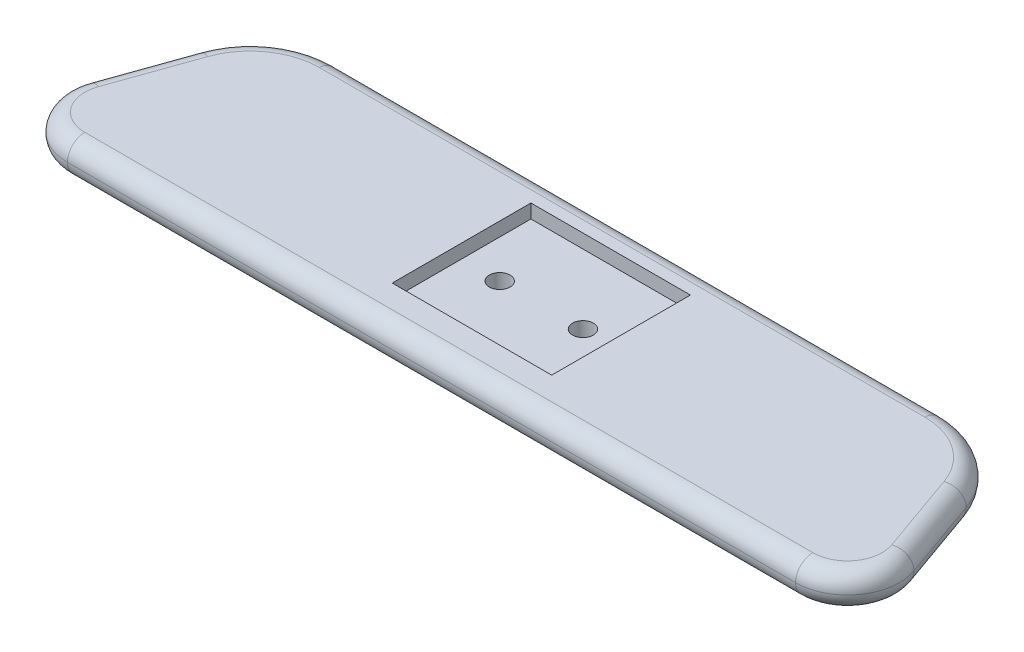
from build123d import *

# Parameters (mm, degrees)
BOSS_EXTRUDE1_DEPTH     = 5
CUT_EXTRUDE1_DEPTH      = 125.512560278
CUT_EXTRUDE1_DEPTH_BACK = 4
SKETCH2_W               = 46
SKETCH2_H               = 40
SKETCH3_R               = 3
CUT_EXTRUDE2_DEPTH      = 125.25529231
SKETCH4_R               = 2
CUT_EXTRUDE3_DEPTH      = 8
FILLET1_R               = 5


with BuildPart() as part:
    # Sketch1 → Boss-Extrude1 (new, symmetric)
    with BuildSketch(Plane(origin=(0, 0, 0), x_dir=(1, 0, 0), z_dir=(0, 1, 0))):
        with BuildLine():
            Line((-105, -31.676137185), (105, -31.676137185))
            ThreePointArc((105, -31.676137185), (117.249623327, -25.333315035), (119.139622366, -11.669034296))
            Line((119.139622366, -11.669034296), (110.875178831, 11.669034296))
            ThreePointArc((110.875178831, 11.669034296), (101.737771304, 23.739901694), (87.309141554, 28.323862815))
            Line((87.309141554, 28.323862815), (-87.309141554, 28.323862815))
            ThreePointArc((-87.309141554, 28.323862815), (-101.737771304, 23.739901694), (-110.875178831, 11.669034296))
            Line((-110.875178831, 11.669034296), (-119.139622366, -11.669034296))
            ThreePointArc((-119.139622366, -11.669034296), (-117.249623327, -25.333315035), (-105, -31.676137185))
        make_face()
    extrude(amount=BOSS_EXTRUDE1_DEPTH, both=True)

    # Sketch2 → Cut-Extrude1 (cut, two sides: drawn at the far end of the back side and taken through both)
    with BuildSketch(Plane(origin=(0, 5, 0), x_dir=(1, 0, 0), z_dir=(0, 1, 0)).offset(-CUT_EXTRUDE1_DEPTH_BACK)):
        Rectangle(SKETCH2_W, SKETCH2_H)
    extrude(amount=CUT_EXTRUDE1_DEPTH + CUT_EXTRUDE1_DEPTH_BACK, mode=Mode.SUBTRACT)

    # Sketch3 → Cut-Extrude2 (cut, through all)
    with BuildSketch(Plane(origin=(0, 1, 0), x_dir=(1, 0, 0), z_dir=(0, 1, 0))):
        with Locations(Location((12, 0, 0), (0, 0, 270))):
            Circle(SKETCH3_R)
        with Locations(Location((-12, 0, 0), (0, 0, 270))):
            Circle(SKETCH3_R)
    extrude(amount=-CUT_EXTRUDE2_DEPTH, mode=Mode.SUBTRACT)

    # Sketch4 → Cut-Extrude3 (cut)
    with BuildSketch(Plane.XZ.offset(5)):
        with Locations(Location((-70, 9.676137185, 0), (0, 0, 270))):
            Circle(SKETCH4_R)
        with Locations(Location((-70, -6.323862815, 0), (0, 0, 270))):
            Circle(SKETCH4_R)
        with Locations(Location((70, -6.323862815, 0), (0, 0, 270))):
            Circle(SKETCH4_R)
        with Locations(Location((70, 9.676137185, 0), (0, 0, 270))):
            Circle(SKETCH4_R)
    extrude(amount=-CUT_EXTRUDE3_DEPTH, mode=Mode.SUBTRACT)

    # Fillet1
    fillet1_edges = [part.edges().sort_by_distance(p)[0] for p in [
        (101.737771304, -5, -23.739901694),
        (115.007400599, -5, 0),
        (117.249623327, -5, 25.333315035),
        (0, -5, 31.676137185),
        (-117.249623327, -5, 25.333315035),
        (-115.007400599, -5, 0),
        (-101.737771304, -5, -23.739901694),
        (-117.249623327, 5, 25.333315035),
        (-115.007400599, 5, 0),
        (-101.737771304, 5, -23.739901694),
        (0, 5, -28.323862815),
        (101.737771304, 5, -23.739901694),
        (115.007400599, 5, 0),
        (117.249623327, 5, 25.333315035),
        (0, -5, -28.323862815),
        (0, 5, 31.676137185),
    ]]
    fillet(fillet1_edges, radius=FILLET1_R - 0.0001)  # a hair under: the kernel refuses the full size


solid = part.part
